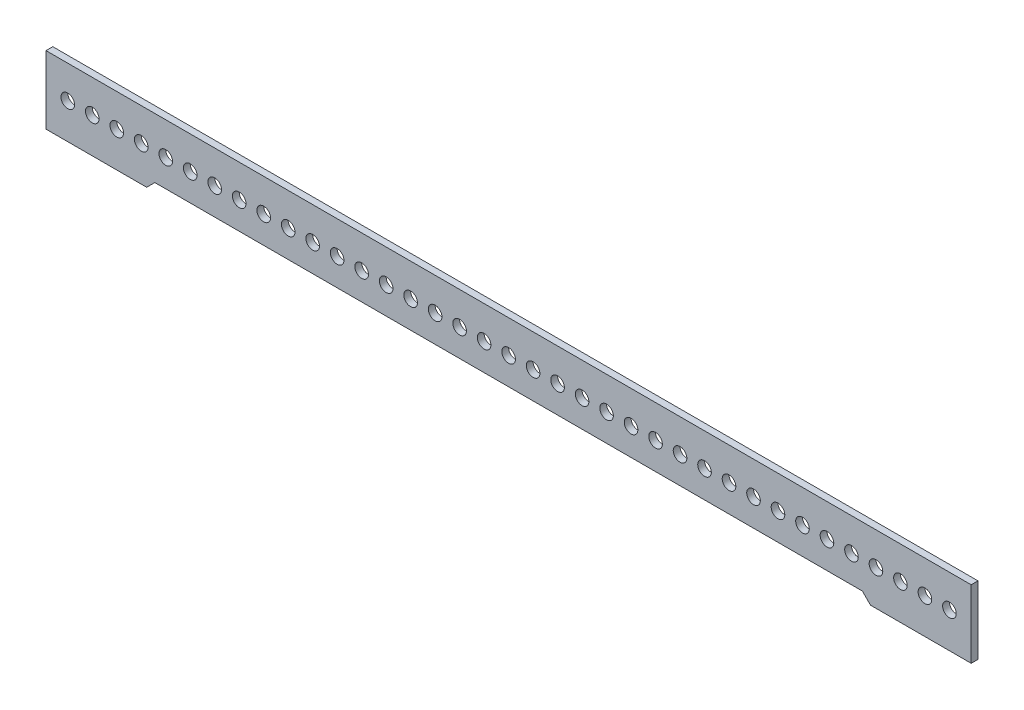
from build123d import *

# Parameters (mm, degrees)
BOSS_EXTRUDE1_DEPTH = 3.175
SKETCH3_R           = 3.175
CUT_EXTRUDE2_DEPTH  = 219.245167472


with BuildPart() as part:
    # Sketch1 → Boss-Extrude1 (new body)
    with BuildSketch(Plane.XY):
        Polygon((-215.9, 0), (215.9, 0), (215.9, -31.75), (168.91, -31.75), (165.1, -27.94), (-165.1, -27.94), (-168.91, -31.75), (-215.9, -31.75), align=None)
    extrude(amount=BOSS_EXTRUDE1_DEPTH)

    # Sketch3 → Cut-Extrude2 (cut, through all)
    with BuildSketch(Plane.XY.offset(3.175)):
        with Locations((-205.74, -15.24)):
            Circle(SKETCH3_R)
        with Locations((-194.31, -15.24)):
            Circle(SKETCH3_R)
        with Locations((-182.88, -15.24)):
            Circle(SKETCH3_R)
        with Locations((-171.45, -15.24)):
            Circle(SKETCH3_R)
        with Locations((-160.02, -15.24)):
            Circle(SKETCH3_R)
        with Locations((-148.59, -15.24)):
            Circle(SKETCH3_R)
        with Locations((-137.16, -15.24)):
            Circle(SKETCH3_R)
        with Locations((-125.73, -15.24)):
            Circle(SKETCH3_R)
        with Locations((-114.3, -15.24)):
            Circle(SKETCH3_R)
        with Locations((-102.87, -15.24)):
            Circle(SKETCH3_R)
        with Locations((-91.44, -15.24)):
            Circle(SKETCH3_R)
        with Locations((-80.01, -15.24)):
            Circle(SKETCH3_R)
        with Locations((-68.58, -15.24)):
            Circle(SKETCH3_R)
        with Locations((-57.15, -15.24)):
            Circle(SKETCH3_R)
        with Locations((-45.72, -15.24)):
            Circle(SKETCH3_R)
        with Locations((-34.29, -15.24)):
            Circle(SKETCH3_R)
        with Locations((-22.86, -15.24)):
            Circle(SKETCH3_R)
        with Locations((-11.43, -15.24)):
            Circle(SKETCH3_R)
        with Locations((0, -15.24)):
            Circle(SKETCH3_R)
        with Locations((11.43, -15.24)):
            Circle(SKETCH3_R)
        with Locations((22.86, -15.24)):
            Circle(SKETCH3_R)
        with Locations((34.29, -15.24)):
            Circle(SKETCH3_R)
        with Locations((45.72, -15.24)):
            Circle(SKETCH3_R)
        with Locations((57.15, -15.24)):
            Circle(SKETCH3_R)
        with Locations((68.58, -15.24)):
            Circle(SKETCH3_R)
        with Locations((80.01, -15.24)):
            Circle(SKETCH3_R)
        with Locations((91.44, -15.24)):
            Circle(SKETCH3_R)
        with Locations((102.87, -15.24)):
            Circle(SKETCH3_R)
        with Locations((114.3, -15.24)):
            Circle(SKETCH3_R)
        with Locations((125.73, -15.24)):
            Circle(SKETCH3_R)
        with Locations((137.16, -15.24)):
            Circle(SKETCH3_R)
        with Locations((148.59, -15.24)):
            Circle(SKETCH3_R)
        with Locations((160.02, -15.24)):
            Circle(SKETCH3_R)
        with Locations((171.45, -15.24)):
            Circle(SKETCH3_R)
        with Locations((182.88, -15.24)):
            Circle(SKETCH3_R)
        with Locations((194.31, -15.24)):
            Circle(SKETCH3_R)
        with Locations((205.74, -15.24)):
            Circle(SKETCH3_R)
    extrude(amount=-CUT_EXTRUDE2_DEPTH, mode=Mode.SUBTRACT)


solid = part.part
